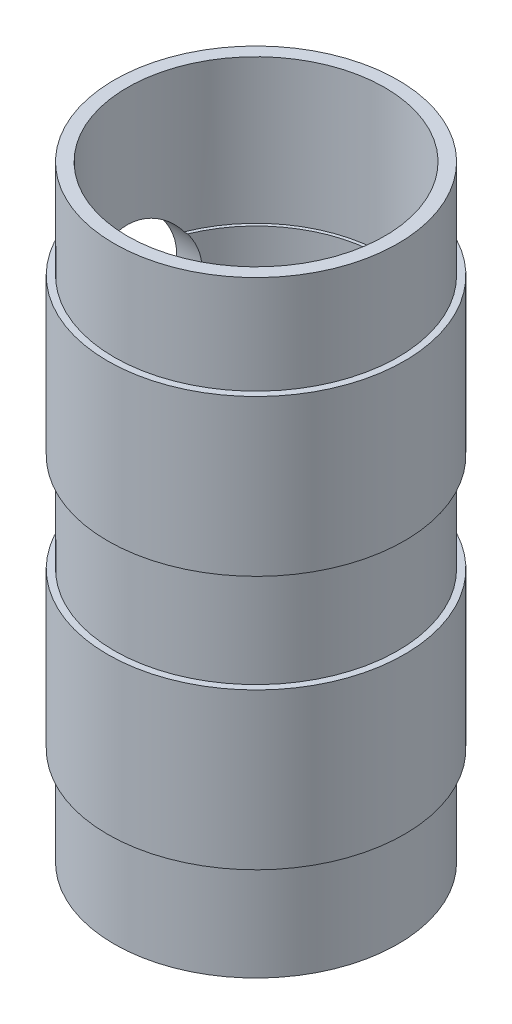
from build123d import *

# Parameters (mm, degrees)
SKETCH1_R           = 45.25
SKETCH1_R_2         = 38.25
BOSS_EXTRUDE1_DEPTH = 92.5
BOSS_EXTRUDE2_START = -6.35
SKETCH2_R           = 38.25
SKETCH2_R_2         = 36.25
BOSS_EXTRUDE2_DEPTH = 100
CUT_EXTRUDE3_START  = -44
SKETCH6_R           = 39.25
SKETCH6_R_2         = 38.25
CUT_EXTRUDE3_DEPTH  = 44
SKETCH7_R           = 17.5
CUT_EXTRUDE4_DEPTH  = 113.478331247
SKETCH8_R           = 45.25
SKETCH8_R_2         = 43.25
CUT_EXTRUDE5_DEPTH  = 30
SKETCH9_R           = 45.25
SKETCH9_R_2         = 43.25
CUT_EXTRUDE6_DEPTH  = 15


with BuildPart() as part:
    # Sketch1 → Boss-Extrude1 (new, symmetric)
    with BuildSketch(Plane(origin=(0, 0, 0), x_dir=(1, 0, 0), z_dir=(0, 1, 0))):
        Circle(SKETCH1_R)
        Circle(SKETCH1_R_2, mode=Mode.SUBTRACT)
    extrude(amount=BOSS_EXTRUDE1_DEPTH, both=True)

    # Sketch2 → Boss-Extrude2 (add)
    with BuildSketch(Plane.XZ.offset(92.5).offset(BOSS_EXTRUDE2_START)):
        Circle(SKETCH2_R)
        Circle(SKETCH2_R_2, mode=Mode.SUBTRACT)
    extrude(amount=-BOSS_EXTRUDE2_DEPTH)

    # Sketch6 → Cut-Extrude3 (cut)
    with BuildSketch(Plane(origin=(0, 92.5, 0), x_dir=(1, 0, 0), z_dir=(0, 1, 0)).offset(CUT_EXTRUDE3_START)):
        Circle(SKETCH6_R)
        Circle(SKETCH6_R_2, mode=Mode.SUBTRACT)
    extrude(amount=CUT_EXTRUDE3_DEPTH, mode=Mode.SUBTRACT)

    # Sketch7 → Cut-Extrude4 (cut, through all)
    with BuildSketch(Plane(origin=(0, 0, 0), x_dir=(0, 0, -1), z_dir=(1, 0, 0))):
        with Locations((0, 38.75)):
            Circle(SKETCH7_R)
    extrude(amount=-CUT_EXTRUDE4_DEPTH, mode=Mode.SUBTRACT)

    # Sketch8 → Cut-Extrude5 (cut)
    with BuildSketch(Plane(origin=(0, 92.5, 0), x_dir=(1, 0, 0), z_dir=(0, 1, 0))):
        Circle(SKETCH8_R)
        Circle(SKETCH8_R_2, mode=Mode.SUBTRACT)
    cut_extrude5 = extrude(amount=-CUT_EXTRUDE5_DEPTH, mode=Mode.SUBTRACT)

    # Mirror1: Cut-Extrude5 across plane
    add(cut_extrude5.mirror(Plane.ZX), mode=Mode.SUBTRACT)

    # Sketch9 → Cut-Extrude6 (cut, symmetric)
    with BuildSketch(Plane(origin=(0, 0, 0), x_dir=(1, 0, 0), z_dir=(0, 1, 0))):
        Circle(SKETCH9_R)
        Circle(SKETCH9_R_2, mode=Mode.SUBTRACT)
    extrude(amount=CUT_EXTRUDE6_DEPTH, both=True, mode=Mode.SUBTRACT)


solid = part.part
